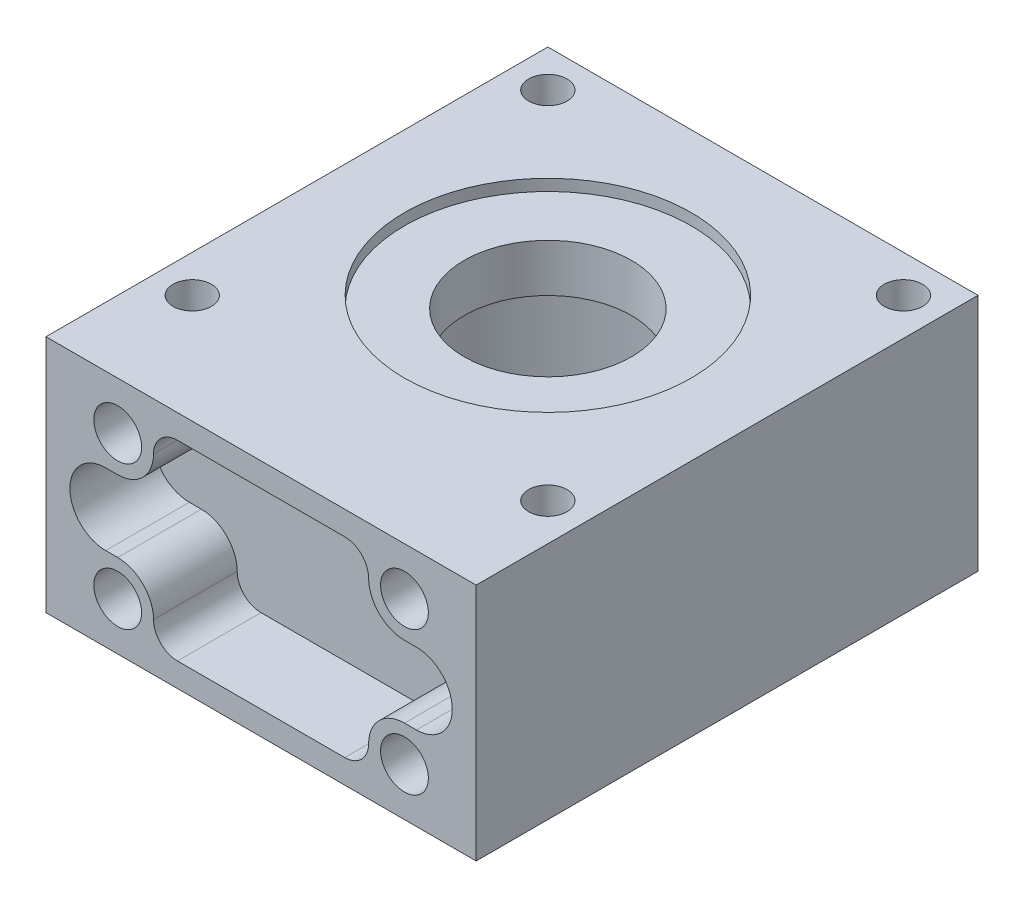
from build123d import *

# Parameters (mm, degrees)
SKETCH1_R                         = 2.5527
BOSS_EXTRUDE1_DEPTH               = 31.75
SKETCH2_R                         = 19.05
CUT_EXTRUDE1_DEPTH                = 1.524
SKETCH3_R                         = 11.1125
CUT_EXTRUDE2_DEPTH                = 57.407018189
CUT_EXTRUDE3_DEPTH                = 23.876
SKETCH5_R                         = 26.19375
CUT_EXTRUDE4_DEPTH                = 17.526
CUT_EXTRUDE5_DEPTH                = 1.5875
F_1_4_20_TAPPED_HOLE1_D           = 5.1054
F_1_4_20_TAPPED_HOLE1_DEPTH       = 9.652
F_1_4_20_TAPPED_HOLE1_CBORE_D     = 6.35
F_1_4_20_TAPPED_HOLE1_CBORE_DEPTH = 9.525
F_1_4_20_TAPPED_HOLE1_TIP         = 1.533816902
CUT_EXTRUDE6_DEPTH                = 11.1125


with BuildPart() as part:
    # Sketch1 → Boss-Extrude1 (new body)
    with BuildSketch(Plane(origin=(0, 0, 0), x_dir=(1, 0, 0), z_dir=(0, 1, 0))):
        Polygon((28.575, 28.575), (-28.575, 28.575), (-28.575, -28.575), (-28.575, -38.1), (28.575, -38.1), (28.575, -28.575), align=None)
        with Locations((23.622, -23.622)):
            Circle(SKETCH1_R, mode=Mode.SUBTRACT)
        with Locations((23.622, 23.622)):
            Circle(SKETCH1_R, mode=Mode.SUBTRACT)
        with Locations((-23.622, 23.622)):
            Circle(SKETCH1_R, mode=Mode.SUBTRACT)
        with Locations((-23.622, -23.622)):
            Circle(SKETCH1_R, mode=Mode.SUBTRACT)
    extrude(amount=BOSS_EXTRUDE1_DEPTH)

    # Sketch2 → Cut-Extrude1 (cut)
    with BuildSketch(Plane(origin=(0, 31.75, 0), x_dir=(1, 0, 0), z_dir=(0, 1, 0))):
        Circle(SKETCH2_R)
    extrude(amount=-CUT_EXTRUDE1_DEPTH, mode=Mode.SUBTRACT)

    # Sketch3 → Cut-Extrude2 (cut, through all)
    with BuildSketch(Plane(origin=(0, 30.226, 0), x_dir=(1, 0, 0), z_dir=(0, 1, 0))):
        Circle(SKETCH3_R)
    extrude(amount=-CUT_EXTRUDE2_DEPTH, mode=Mode.SUBTRACT)

    # Sketch4 → Cut-Extrude3 (cut)
    with BuildSketch(Plane.XZ):
        with BuildLine():
            ThreePointArc((0, 20.955), (1.652808564, 21.41912397), (2.822399445, 22.675803874))
            ThreePointArc((2.822399445, 22.675803874), (7.210100154, 24.555346085), (9.885111639, 20.602004462))
            ThreePointArc((9.885111639, 20.602004462), (10.189621648, 18.912489483), (11.32912833, 17.62846778))
            ThreePointArc((11.32912833, 17.62846778), (12.970483736, 17.125337937), (14.633818648, 17.550195776))
            ThreePointArc((14.633818648, 17.550195776), (19.341144607, 16.759197203), (19.454169622, 11.9872142))
            ThreePointArc((19.454169622, 11.9872142), (18.796918984, 10.401273215), (19.061338463, 8.705021597))
            ThreePointArc((19.061338463, 8.705021597), (20.170121967, 7.39437811), (21.799103827, 6.852524522))
            ThreePointArc((21.799103827, 6.852524522), (25.331512305, 3.642121623), (22.846666207, -0.433431873))
            ThreePointArc((22.846666207, -0.433431873), (21.436327355, -1.412273807), (20.741708315, -2.982207436))
            ThreePointArc((20.741708315, -2.982207436), (20.965888988, -4.68424452), (22.043327566, -6.02077485))
            ThreePointArc((22.043327566, -6.02077485), (23.27930383, -10.631301837), (18.985507698, -12.716466389))
            ThreePointArc((18.985507698, -12.716466389), (17.269853253, -12.777433874), (15.836732331, -13.72260668))
            ThreePointArc((15.836732331, -13.72260668), (15.105134394, -15.275652613), (15.288950554, -16.982520747))
            ThreePointArc((15.288950554, -16.982520747), (13.836080873, -21.529362082), (9.09658464, -20.962112676))
            ThreePointArc((9.09658464, -20.962112676), (7.620322766, -20.085848967), (5.903705729, -20.106175262))
            ThreePointArc((5.903705729, -20.106175262), (4.448606357, -21.017148933), (3.680439768, -22.552436301))
            ThreePointArc((3.680439768, -22.552436301), (0, -25.592001984), (-3.680439768, -22.552436301))
            ThreePointArc((-3.680439768, -22.552436301), (-4.448606357, -21.017148933), (-5.903705729, -20.106175262))
            ThreePointArc((-5.903705729, -20.106175262), (-7.620322766, -20.085848967), (-9.09658464, -20.962112676))
            ThreePointArc((-9.09658464, -20.962112676), (-13.836080873, -21.529362082), (-15.288950554, -16.982520747))
            ThreePointArc((-15.288950554, -16.982520747), (-15.105134394, -15.275652613), (-15.836732331, -13.72260668))
            ThreePointArc((-15.836732331, -13.72260668), (-17.269853253, -12.777433874), (-18.985507698, -12.716466389))
            ThreePointArc((-18.985507698, -12.716466389), (-23.27930383, -10.631301837), (-22.043327566, -6.02077485))
            ThreePointArc((-22.043327566, -6.02077485), (-20.965888988, -4.68424452), (-20.741708315, -2.982207436))
            ThreePointArc((-20.741708315, -2.982207436), (-21.436327355, -1.412273807), (-22.846666207, -0.433431873))
            ThreePointArc((-22.846666207, -0.433431873), (-25.331512305, 3.642121623), (-21.799103827, 6.852524522))
            ThreePointArc((-21.799103827, 6.852524522), (-20.170121967, 7.39437811), (-19.061338463, 8.705021597))
            ThreePointArc((-19.061338463, 8.705021597), (-18.796918984, 10.401273215), (-19.454169622, 11.9872142))
            ThreePointArc((-19.454169622, 11.9872142), (-19.341144607, 16.759197203), (-14.633818648, 17.550195776))
            ThreePointArc((-14.633818648, 17.550195776), (-12.970483736, 17.125337937), (-11.32912833, 17.62846778))
            ThreePointArc((-11.32912833, 17.62846778), (-10.189621648, 18.912489483), (-9.885111639, 20.602004462))
            ThreePointArc((-9.885111639, 20.602004462), (-7.210100154, 24.555346085), (-2.822399445, 22.675803874))
            ThreePointArc((-2.822399445, 22.675803874), (-1.652808564, 21.41912397), (0, 20.955))
        make_face()
    extrude(amount=-CUT_EXTRUDE3_DEPTH, mode=Mode.SUBTRACT)

    # Sketch5 → Cut-Extrude4 (cut)
    with BuildSketch(Plane.XZ):
        Circle(SKETCH5_R)
    extrude(amount=-CUT_EXTRUDE4_DEPTH, mode=Mode.SUBTRACT)

    # Sketch7 → Cut-Extrude5 (cut)
    with BuildSketch(Plane.XZ):
        with BuildLine():
            Line((-23.8125, 26.9875), (23.8125, 26.9875))
            ThreePointArc((23.8125, 26.9875), (26.05756403, 26.05756403), (26.9875, 23.8125))
            Line((26.9875, 23.8125), (26.9875, -23.8125))
            ThreePointArc((26.9875, -23.8125), (26.05756403, -26.05756403), (23.8125, -26.9875))
            Line((23.8125, -26.9875), (-23.8125, -26.9875))
            ThreePointArc((-23.8125, -26.9875), (-26.05756403, -26.05756403), (-26.9875, -23.8125))
            Line((-26.9875, -23.8125), (-26.9875, 23.8125))
            ThreePointArc((-26.9875, 23.8125), (-26.05756403, 26.05756403), (-23.8125, 26.9875))
        make_face()
    extrude(amount=-CUT_EXTRUDE5_DEPTH, mode=Mode.SUBTRACT)

    # 1/4-20 Tapped Hole1
    with Locations(Plane.XY.offset(38.1)):
        with Locations((-19.05, 25.4), (19.05, 25.4), (19.05, 6.35), (-19.05, 6.35)):
            CounterBoreHole(F_1_4_20_TAPPED_HOLE1_D / 2, F_1_4_20_TAPPED_HOLE1_CBORE_D / 2, F_1_4_20_TAPPED_HOLE1_CBORE_DEPTH, depth=F_1_4_20_TAPPED_HOLE1_DEPTH)
            with Locations((0, 0, -(F_1_4_20_TAPPED_HOLE1_DEPTH + F_1_4_20_TAPPED_HOLE1_TIP / 2))):  # 118° drill point
                Cone(0, F_1_4_20_TAPPED_HOLE1_D / 2, F_1_4_20_TAPPED_HOLE1_TIP, mode=Mode.SUBTRACT)

    # Sketch13 → Cut-Extrude6 (cut)
    with BuildSketch(Plane.XY.offset(38.1)):
        with BuildLine():
            Line((-20.6375, 11.1125), (-19.05, 11.1125))
            ThreePointArc((-19.05, 11.1125), (-15.682403955, 9.717596045), (-14.2875, 6.35))
            ThreePointArc((-14.2875, 6.35), (-13.35756403, 4.10493597), (-11.1125, 3.175))
            Line((-11.1125, 3.175), (11.1125, 3.175))
            ThreePointArc((11.1125, 3.175), (13.35756403, 4.10493597), (14.2875, 6.35))
            ThreePointArc((14.2875, 6.35), (15.682403955, 9.717596045), (19.05, 11.1125))
            Line((19.05, 11.1125), (20.6375, 11.1125))
            ThreePointArc((20.6375, 11.1125), (25.4, 15.875), (20.6375, 20.6375))
            Line((20.6375, 20.6375), (19.05, 20.6375))
            ThreePointArc((19.05, 20.6375), (15.682403955, 22.032403955), (14.2875, 25.4))
            ThreePointArc((14.2875, 25.4), (13.35756403, 27.64506403), (11.1125, 28.575))
            Line((11.1125, 28.575), (-11.1125, 28.575))
            ThreePointArc((-11.1125, 28.575), (-13.35756403, 27.64506403), (-14.2875, 25.4))
            ThreePointArc((-14.2875, 25.4), (-15.682403955, 22.032403955), (-19.05, 20.6375))
            Line((-19.05, 20.6375), (-20.6375, 20.6375))
            ThreePointArc((-20.6375, 20.6375), (-25.4, 15.875), (-20.6375, 11.1125))
        make_face()
    extrude(amount=-CUT_EXTRUDE6_DEPTH, mode=Mode.SUBTRACT)


solid = part.part
